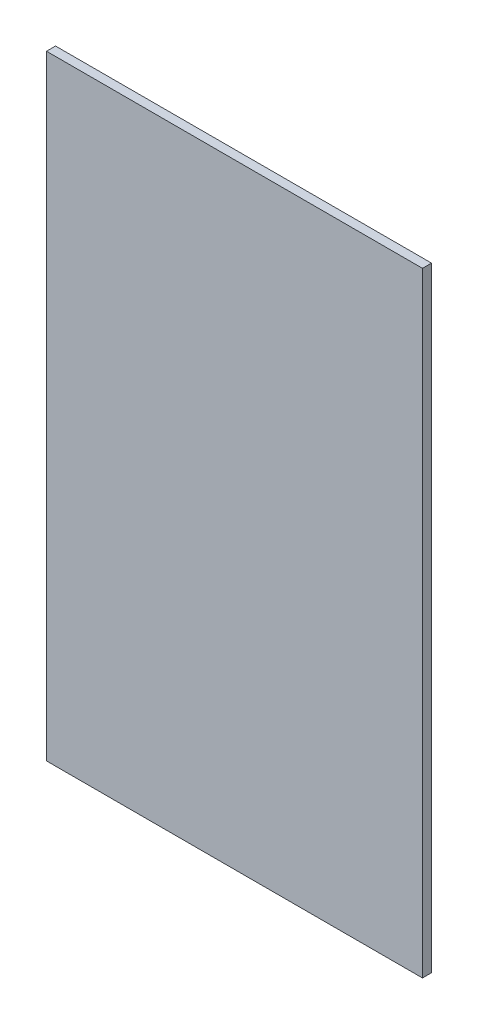
from build123d import *

# Parameters (mm, degrees)
SKETCH1_W           = 208
SKETCH1_H           = 400
BOSS_EXTRUDE1_DEPTH = 2.5
SKETCH2_W           = 359.169173544
SKETCH2_H           = 71.825535335
CUT_EXTRUDE1_DEPTH  = 226.479489089


with BuildPart() as part:
    # Sketch1 → Boss-Extrude1 (new, symmetric)
    with BuildSketch(Plane.XY):
        Rectangle(SKETCH1_W, SKETCH1_H)
    extrude(amount=BOSS_EXTRUDE1_DEPTH, both=True)

    # Sketch2 → Cut-Extrude1 (cut, through all)
    with BuildSketch(Plane.XY.offset(2.5)):
        with Locations((24.370605125, 175.912767668)):
            Rectangle(SKETCH2_W, SKETCH2_H)
    extrude(amount=-CUT_EXTRUDE1_DEPTH, mode=Mode.SUBTRACT)


solid = part.part
